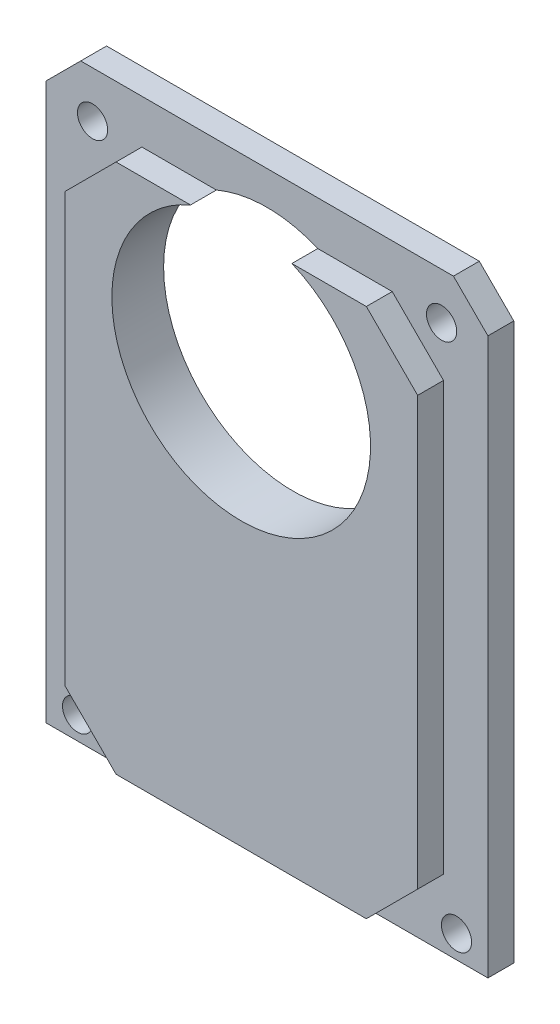
from build123d import *

# Parameters (mm, degrees)
SKETCH1_W           = 51.23
SKETCH1_H           = 68.5
BOSS_EXTRUDE1_DEPTH = 3
CHAMFER1_SIZE       = 4
SKETCH3_W           = 40.93
SKETCH3_H           = 61.5
BOSS_EXTRUDE3_DEPTH = 3
CHAMFER2_SIZE       = 5.95
SKETCH4_R           = 1.75
CUT_EXTRUDE1_DEPTH  = 43.874126522
SKETCH5_R           = 15
CUT_EXTRUDE2_DEPTH  = 44.187853906


with BuildPart() as part:
    # Sketch1 → Boss-Extrude1 (new body)
    with BuildSketch(Plane.XY):
        Rectangle(SKETCH1_W, SKETCH1_H)
    extrude(amount=BOSS_EXTRUDE1_DEPTH)

    # Chamfer1
    chamfer1_edges = [part.edges().sort_by_distance(p)[0] for p in [
        (25.615, 34.25, 1.5),
        (-25.615, 34.25, 1.5),
    ]]
    chamfer(chamfer1_edges, length=CHAMFER1_SIZE)

    # Sketch3 → Boss-Extrude3 (add)
    with BuildSketch(Plane.XY.offset(3)):
        with Locations((0, -1.6)):
            Rectangle(SKETCH3_W, SKETCH3_H)
    extrude(amount=BOSS_EXTRUDE3_DEPTH)

    # Chamfer2
    chamfer2_edges = [part.edges().sort_by_distance(p)[0] for p in [
        (20.465, -32.35, 4.5),
        (-20.465, -32.35, 4.5),
        (-20.465, 29.15, 4.5),
        (20.465, 29.15, 4.5),
    ]]
    chamfer(chamfer2_edges, length=CHAMFER2_SIZE)

    # Sketch4 → Cut-Extrude1 (cut, through all)
    with BuildSketch(Plane.XY.offset(3)):
        with Locations((-20.242100654, 28.877100654)):
            Circle(SKETCH4_R)
        with Locations((20.242100654, 28.877100654)):
            Circle(SKETCH4_R)
        with Locations((21.974423525, -31.604966365)):
            Circle(SKETCH4_R)
        with Locations((-21.974423525, -31.604966365)):
            Circle(SKETCH4_R)
    extrude(amount=-CUT_EXTRUDE1_DEPTH, mode=Mode.SUBTRACT)

    # Sketch5 → Cut-Extrude2 (cut, through all)
    with BuildSketch(Plane(origin=(0, 0, 0), x_dir=(-1, 0, 0), z_dir=(0, 0, -1))):
        with Locations((0, 15.35)):
            Circle(SKETCH5_R)
    extrude(amount=-CUT_EXTRUDE2_DEPTH, mode=Mode.SUBTRACT)


solid = part.part
